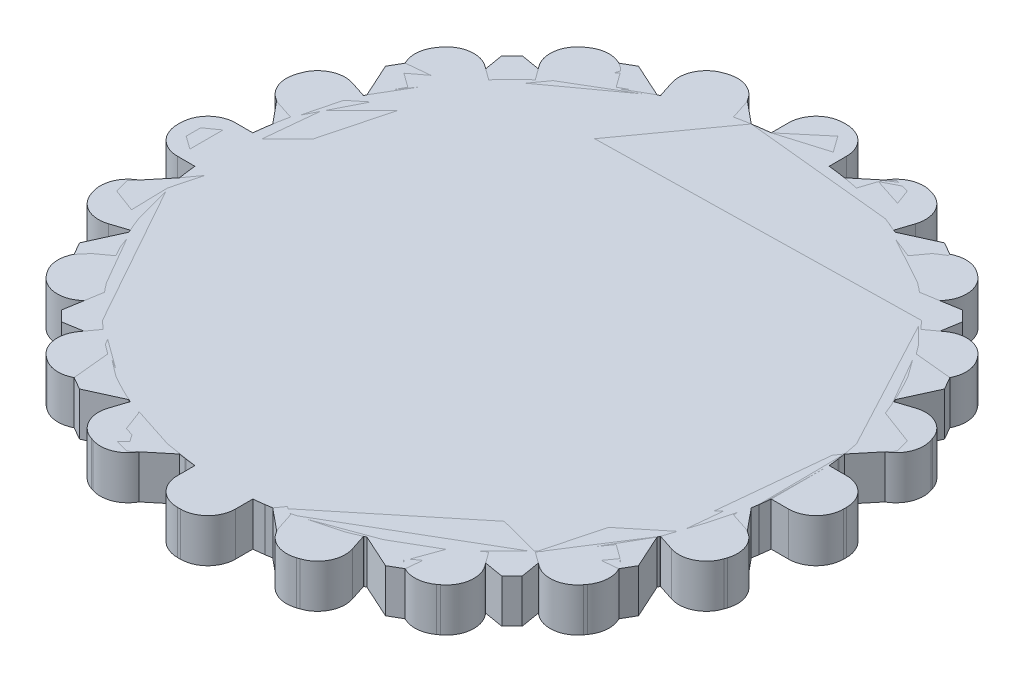
from build123d import *

# Parameters (mm, degrees)
BOSS_EXTRUDE3_DEPTH = 3
BOSS_EXTRUDE5_DEPTH = 3
SKETCH1_W           = 5
SKETCH1_H           = 3
BOSS_EXTRUDE6_DEPTH = 3


with BuildPart() as part:
    # Sketch2 → Boss-Extrude3 (new body)
    with BuildSketch(Plane(origin=(0, 0, 0), x_dir=(1, 0, 0), z_dir=(0, 1, 0))):
        with BuildLine():
            Line((-23, 0.1), (-23, -0.1))
            ThreePointArc((-23, -0.1), (-22.443502884, -1.443502884), (-21.1, -2))
            Line((-21.1, -2), (-19.899748742, -2))
            ThreePointArc((-19.899748742, -2), (-19.753766812, -3.128689301), (-19.543819703, -4.247247513))
            Line((-19.543819703, -4.247247513), (-20.685326483, -4.618145549))
            ThreePointArc((-20.685326483, -4.618145549), (-21.791106589, -5.56257098), (-21.905201574, -7.012285219))
            Line((-21.905201574, -7.012285219), (-21.843398175, -7.202496522))
            ThreePointArc((-21.843398175, -7.202496522), (-20.898972744, -8.308276629), (-19.449258505, -8.422371614))
            Line((-19.449258505, -8.422371614), (-18.307751725, -8.051473578))
            ThreePointArc((-18.307751725, -8.051473578), (-17.820130484, -9.079809995), (-17.274805421, -10.078744846))
            Line((-17.274805421, -10.078744846), (-18.245829086, -10.784234835))
            ThreePointArc((-18.245829086, -10.784234835), (-19.005644954, -12.02414164), (-18.666169396, -13.438159103))
            Line((-18.666169396, -13.438159103), (-18.548612345, -13.599962502))
            ThreePointArc((-18.548612345, -13.599962502), (-17.30870554, -14.35977837), (-15.894688077, -14.020302812))
            Line((-15.894688077, -14.020302812), (-14.923664412, -13.314812824))
            ThreePointArc((-14.923664412, -13.314812824), (-14.142135624, -14.142135624), (-13.314812824, -14.923664412))
            Line((-13.314812824, -14.923664412), (-14.020302812, -15.894688077))
            ThreePointArc((-14.020302812, -15.894688077), (-14.35977837, -17.30870554), (-13.599962502, -18.548612345))
            Line((-13.599962502, -18.548612345), (-13.438159103, -18.666169396))
            ThreePointArc((-13.438159103, -18.666169396), (-12.02414164, -19.005644954), (-10.784234835, -18.245829086))
            Line((-10.784234835, -18.245829086), (-10.078744846, -17.274805421))
            ThreePointArc((-10.078744846, -17.274805421), (-9.079809995, -17.820130484), (-8.051473578, -18.307751725))
            Line((-8.051473578, -18.307751725), (-8.422371614, -19.449258505))
            ThreePointArc((-8.422371614, -19.449258505), (-8.308276629, -20.898972744), (-7.202496522, -21.843398175))
            Line((-7.202496522, -21.843398175), (-7.012285219, -21.905201574))
            ThreePointArc((-7.012285219, -21.905201574), (-5.56257098, -21.791106589), (-4.618145549, -20.685326483))
            Line((-4.618145549, -20.685326483), (-4.247247513, -19.543819703))
            ThreePointArc((-4.247247513, -19.543819703), (-3.128689301, -19.753766812), (-2, -19.899748742))
            Line((-2, -19.899748742), (-2, -21.1))
            ThreePointArc((-2, -21.1), (-1.443502884, -22.443502884), (-0.1, -23))
            Line((-0.1, -23), (0.1, -23))
            ThreePointArc((0.1, -23), (1.443502884, -22.443502884), (2, -21.1))
            Line((2, -21.1), (2, -19.899748742))
            ThreePointArc((2, -19.899748742), (3.128689301, -19.753766812), (4.247247513, -19.543819703))
            Line((4.247247513, -19.543819703), (4.618145549, -20.685326483))
            ThreePointArc((4.618145549, -20.685326483), (5.56257098, -21.791106589), (7.012285219, -21.905201574))
            Line((7.012285219, -21.905201574), (7.202496522, -21.843398175))
            ThreePointArc((7.202496522, -21.843398175), (8.308276629, -20.898972744), (8.422371614, -19.449258505))
            Line((8.422371614, -19.449258505), (8.051473578, -18.307751725))
            ThreePointArc((8.051473578, -18.307751725), (9.079809995, -17.820130484), (10.078744846, -17.274805421))
            Line((10.078744846, -17.274805421), (10.784234835, -18.245829086))
            ThreePointArc((10.784234835, -18.245829086), (12.02414164, -19.005644954), (13.438159103, -18.666169396))
            Line((13.438159103, -18.666169396), (13.599962502, -18.548612345))
            ThreePointArc((13.599962502, -18.548612345), (14.35977837, -17.30870554), (14.020302812, -15.894688077))
            Line((14.020302812, -15.894688077), (13.314812824, -14.923664412))
            ThreePointArc((13.314812824, -14.923664412), (14.142135624, -14.142135624), (14.923664412, -13.314812824))
            Line((14.923664412, -13.314812824), (15.894688077, -14.020302812))
            ThreePointArc((15.894688077, -14.020302812), (17.30870554, -14.35977837), (18.548612345, -13.599962502))
            Line((18.548612345, -13.599962502), (18.666169396, -13.438159103))
            ThreePointArc((18.666169396, -13.438159103), (19.005644954, -12.02414164), (18.245829086, -10.784234835))
            Line((18.245829086, -10.784234835), (17.274805421, -10.078744846))
            ThreePointArc((17.274805421, -10.078744846), (17.820130484, -9.079809995), (18.307751725, -8.051473578))
            Line((18.307751725, -8.051473578), (19.449258505, -8.422371614))
            ThreePointArc((19.449258505, -8.422371614), (20.898972744, -8.308276629), (21.843398175, -7.202496522))
            Line((21.843398175, -7.202496522), (21.905201574, -7.012285219))
            ThreePointArc((21.905201574, -7.012285219), (21.791106589, -5.56257098), (20.685326483, -4.618145549))
            Line((20.685326483, -4.618145549), (19.543819703, -4.247247513))
            ThreePointArc((19.543819703, -4.247247513), (19.753766812, -3.128689301), (19.899748742, -2))
            Line((19.899748742, -2), (21.1, -2))
            ThreePointArc((21.1, -2), (22.443502884, -1.443502884), (23, -0.1))
            Line((23, -0.1), (23, 0.1))
            ThreePointArc((23, 0.1), (22.443502884, 1.443502884), (21.1, 2))
            Line((21.1, 2), (19.899748742, 2))
            ThreePointArc((19.899748742, 2), (19.753766812, 3.128689301), (19.543819703, 4.247247513))
            Line((19.543819703, 4.247247513), (20.685326483, 4.618145549))
            ThreePointArc((20.685326483, 4.618145549), (21.791106589, 5.56257098), (21.905201574, 7.012285219))
            Line((21.905201574, 7.012285219), (21.843398175, 7.202496522))
            ThreePointArc((21.843398175, 7.202496522), (20.898972744, 8.308276629), (19.449258505, 8.422371614))
            Line((19.449258505, 8.422371614), (18.307751725, 8.051473578))
            ThreePointArc((18.307751725, 8.051473578), (17.820130484, 9.079809995), (17.274805421, 10.078744846))
            Line((17.274805421, 10.078744846), (18.245829086, 10.784234835))
            ThreePointArc((18.245829086, 10.784234835), (19.005644954, 12.02414164), (18.666169396, 13.438159103))
            Line((18.666169396, 13.438159103), (18.548612345, 13.599962502))
            ThreePointArc((18.548612345, 13.599962502), (17.30870554, 14.35977837), (15.894688077, 14.020302812))
            Line((15.894688077, 14.020302812), (14.923664412, 13.314812824))
            ThreePointArc((14.923664412, 13.314812824), (14.142135624, 14.142135624), (13.314812824, 14.923664412))
            Line((13.314812824, 14.923664412), (14.020302812, 15.894688077))
            ThreePointArc((14.020302812, 15.894688077), (14.35977837, 17.30870554), (13.599962502, 18.548612345))
            Line((13.599962502, 18.548612345), (13.438159103, 18.666169396))
            ThreePointArc((13.438159103, 18.666169396), (12.02414164, 19.005644954), (10.784234835, 18.245829086))
            Line((10.784234835, 18.245829086), (10.078744846, 17.274805421))
            ThreePointArc((10.078744846, 17.274805421), (9.079809995, 17.820130484), (8.051473578, 18.307751725))
            Line((8.051473578, 18.307751725), (8.422371614, 19.449258505))
            ThreePointArc((8.422371614, 19.449258505), (8.308276629, 20.898972744), (7.202496522, 21.843398175))
            Line((7.202496522, 21.843398175), (7.012285219, 21.905201574))
            ThreePointArc((7.012285219, 21.905201574), (5.56257098, 21.791106589), (4.618145549, 20.685326483))
            Line((4.618145549, 20.685326483), (4.247247513, 19.543819703))
            ThreePointArc((4.247247513, 19.543819703), (3.128689301, 19.753766812), (2, 19.899748742))
            Line((2, 19.899748742), (2, 21.1))
            ThreePointArc((2, 21.1), (1.443502884, 22.443502884), (0.1, 23))
            Line((0.1, 23), (-0.1, 23))
            ThreePointArc((-0.1, 23), (-1.443502884, 22.443502884), (-2, 21.1))
            Line((-2, 21.1), (-2, 19.899748742))
            ThreePointArc((-2, 19.899748742), (-3.128689301, 19.753766812), (-4.247247513, 19.543819703))
            Line((-4.247247513, 19.543819703), (-4.618145549, 20.685326483))
            ThreePointArc((-4.618145549, 20.685326483), (-5.56257098, 21.791106589), (-7.012285219, 21.905201574))
            Line((-7.012285219, 21.905201574), (-7.202496522, 21.843398175))
            ThreePointArc((-7.202496522, 21.843398175), (-8.308276629, 20.898972744), (-8.422371614, 19.449258505))
            Line((-8.422371614, 19.449258505), (-8.051473578, 18.307751725))
            ThreePointArc((-8.051473578, 18.307751725), (-9.079809995, 17.820130484), (-10.078744846, 17.274805421))
            Line((-10.078744846, 17.274805421), (-10.784234835, 18.245829086))
            ThreePointArc((-10.784234835, 18.245829086), (-12.02414164, 19.005644954), (-13.438159103, 18.666169396))
            Line((-13.438159103, 18.666169396), (-13.599962502, 18.548612345))
            ThreePointArc((-13.599962502, 18.548612345), (-14.35977837, 17.30870554), (-14.020302812, 15.894688077))
            Line((-14.020302812, 15.894688077), (-13.314812824, 14.923664412))
            ThreePointArc((-13.314812824, 14.923664412), (-14.142135624, 14.142135624), (-14.923664412, 13.314812824))
            Line((-14.923664412, 13.314812824), (-15.894688077, 14.020302812))
            ThreePointArc((-15.894688077, 14.020302812), (-17.30870554, 14.35977837), (-18.548612345, 13.599962502))
            Line((-18.548612345, 13.599962502), (-18.666169396, 13.438159103))
            ThreePointArc((-18.666169396, 13.438159103), (-19.005644954, 12.02414164), (-18.245829086, 10.784234835))
            Line((-18.245829086, 10.784234835), (-17.274805421, 10.078744846))
            ThreePointArc((-17.274805421, 10.078744846), (-17.820130484, 9.079809995), (-18.307751725, 8.051473578))
            Line((-18.307751725, 8.051473578), (-19.449258505, 8.422371614))
            ThreePointArc((-19.449258505, 8.422371614), (-20.898972744, 8.308276629), (-21.843398175, 7.202496522))
            Line((-21.843398175, 7.202496522), (-21.905201574, 7.012285219))
            ThreePointArc((-21.905201574, 7.012285219), (-21.791106589, 5.56257098), (-20.685326483, 4.618145549))
            Line((-20.685326483, 4.618145549), (-19.543819703, 4.247247513))
            ThreePointArc((-19.543819703, 4.247247513), (-19.753766812, 3.128689301), (-19.899748742, 2))
            Line((-19.899748742, 2), (-21.1, 2))
            ThreePointArc((-21.1, 2), (-22.443502884, 1.443502884), (-23, 0.1))
        make_face()
    extrude(amount=BOSS_EXTRUDE3_DEPTH)


with BuildPart() as body_2:
    # Sketch3 → Boss-Extrude5 (new body)
    with BuildSketch(Plane(origin=(0, 0, 0), x_dir=(1, 0, 0), z_dir=(0, 1, 0))):
        with BuildLine():
            Line((-22, 0.5), (-22, -0.5))
            Line((-22, -0.5), (-19.899748742, -2))
            ThreePointArc((-19.899748742, -2), (-19.828897227, -2.610523844), (-19.739319337, -3.218582315))
            Line((-19.739319337, -3.218582315), (-21.379777701, -5.211056079))
            Line((-21.379777701, -5.211056079), (-21.120958656, -6.176981905))
            Line((-21.120958656, -6.176981905), (-18.704043156, -7.08228562))
            ThreePointArc((-18.704043156, -7.08228562), (-18.47759065, -7.653668647), (-18.23368794, -8.217823563))
            Line((-18.23368794, -8.217823563), (-19.302558883, -10.566987298))
            Line((-19.302558883, -10.566987298), (-18.802558883, -11.433012702))
            Line((-18.802558883, -11.433012702), (-16.23368794, -11.681925179))
            ThreePointArc((-16.23368794, -11.681925179), (-15.867066806, -12.17522858), (-15.485460842, -12.657033717))
            Line((-15.485460842, -12.657033717), (-15.909902577, -15.202795796))
            Line((-15.909902577, -15.202795796), (-15.202795796, -15.909902577))
            Line((-15.202795796, -15.909902577), (-12.657033717, -15.485460842))
            ThreePointArc((-12.657033717, -15.485460842), (-12.17522858, -15.867066806), (-11.681925179, -16.23368794))
            Line((-11.681925179, -16.23368794), (-11.433012702, -18.802558883))
            Line((-11.433012702, -18.802558883), (-10.566987298, -19.302558883))
            Line((-10.566987298, -19.302558883), (-8.217823563, -18.23368794))
            ThreePointArc((-8.217823563, -18.23368794), (-7.653668647, -18.47759065), (-7.08228562, -18.704043156))
            Line((-7.08228562, -18.704043156), (-6.176981905, -21.120958656))
            Line((-6.176981905, -21.120958656), (-5.211056079, -21.379777701))
            Line((-5.211056079, -21.379777701), (-3.218582315, -19.739319337))
            ThreePointArc((-3.218582315, -19.739319337), (-2.610523844, -19.828897227), (-2, -19.899748742))
            Line((-2, -19.899748742), (-0.5, -22))
            Line((-0.5, -22), (0.5, -22))
            Line((0.5, -22), (2, -19.899748742))
            ThreePointArc((2, -19.899748742), (2.610523844, -19.828897227), (3.218582315, -19.739319337))
            Line((3.218582315, -19.739319337), (5.211056079, -21.379777701))
            Line((5.211056079, -21.379777701), (6.176981905, -21.120958656))
            Line((6.176981905, -21.120958656), (7.08228562, -18.704043156))
            ThreePointArc((7.08228562, -18.704043156), (7.653668647, -18.47759065), (8.217823563, -18.23368794))
            Line((8.217823563, -18.23368794), (10.566987298, -19.302558883))
            Line((10.566987298, -19.302558883), (11.433012702, -18.802558883))
            Line((11.433012702, -18.802558883), (11.681925179, -16.23368794))
            ThreePointArc((11.681925179, -16.23368794), (12.17522858, -15.867066806), (12.657033717, -15.485460842))
            Line((12.657033717, -15.485460842), (15.202795796, -15.909902577))
            Line((15.202795796, -15.909902577), (15.909902577, -15.202795796))
            Line((15.909902577, -15.202795796), (15.485460842, -12.657033717))
            ThreePointArc((15.485460842, -12.657033717), (15.867066806, -12.17522858), (16.23368794, -11.681925179))
            Line((16.23368794, -11.681925179), (18.802558883, -11.433012702))
            Line((18.802558883, -11.433012702), (19.302558883, -10.566987298))
            Line((19.302558883, -10.566987298), (18.23368794, -8.217823563))
            ThreePointArc((18.23368794, -8.217823563), (18.47759065, -7.653668647), (18.704043156, -7.08228562))
            Line((18.704043156, -7.08228562), (21.120958656, -6.176981905))
            Line((21.120958656, -6.176981905), (21.379777701, -5.211056079))
            Line((21.379777701, -5.211056079), (19.739319337, -3.218582315))
            ThreePointArc((19.739319337, -3.218582315), (19.828897227, -2.610523844), (19.899748742, -2))
            Line((19.899748742, -2), (22, -0.5))
            Line((22, -0.5), (22, 0.5))
            Line((22, 0.5), (19.899748742, 2))
            ThreePointArc((19.899748742, 2), (19.828897227, 2.610523844), (19.739319337, 3.218582315))
            Line((19.739319337, 3.218582315), (21.379777701, 5.211056079))
            Line((21.379777701, 5.211056079), (21.120958656, 6.176981905))
            Line((21.120958656, 6.176981905), (18.704043156, 7.08228562))
            ThreePointArc((18.704043156, 7.08228562), (18.47759065, 7.653668647), (18.23368794, 8.217823563))
            Line((18.23368794, 8.217823563), (19.302558883, 10.566987298))
            Line((19.302558883, 10.566987298), (18.802558883, 11.433012702))
            Line((18.802558883, 11.433012702), (16.23368794, 11.681925179))
            ThreePointArc((16.23368794, 11.681925179), (15.867066806, 12.17522858), (15.485460842, 12.657033717))
            Line((15.485460842, 12.657033717), (15.909902577, 15.202795796))
            Line((15.909902577, 15.202795796), (15.202795796, 15.909902577))
            Line((15.202795796, 15.909902577), (12.657033717, 15.485460842))
            ThreePointArc((12.657033717, 15.485460842), (12.17522858, 15.867066806), (11.681925179, 16.23368794))
            Line((11.681925179, 16.23368794), (11.433012702, 18.802558883))
            Line((11.433012702, 18.802558883), (10.566987298, 19.302558883))
            Line((10.566987298, 19.302558883), (8.217823563, 18.23368794))
            ThreePointArc((8.217823563, 18.23368794), (7.653668647, 18.47759065), (7.08228562, 18.704043156))
            Line((7.08228562, 18.704043156), (6.176981905, 21.120958656))
            Line((6.176981905, 21.120958656), (5.211056079, 21.379777701))
            Line((5.211056079, 21.379777701), (3.218582315, 19.739319337))
            ThreePointArc((3.218582315, 19.739319337), (2.610523844, 19.828897227), (2, 19.899748742))
            Line((2, 19.899748742), (0.5, 22))
            Line((0.5, 22), (-0.5, 22))
            Line((-0.5, 22), (-2, 19.899748742))
            ThreePointArc((-2, 19.899748742), (-2.610523844, 19.828897227), (-3.218582315, 19.739319337))
            Line((-3.218582315, 19.739319337), (-5.211056079, 21.379777701))
            Line((-5.211056079, 21.379777701), (-6.176981905, 21.120958656))
            Line((-6.176981905, 21.120958656), (-7.08228562, 18.704043156))
            ThreePointArc((-7.08228562, 18.704043156), (-7.653668647, 18.47759065), (-8.217823563, 18.23368794))
            Line((-8.217823563, 18.23368794), (-10.566987298, 19.302558883))
            Line((-10.566987298, 19.302558883), (-11.433012702, 18.802558883))
            Line((-11.433012702, 18.802558883), (-11.681925179, 16.23368794))
            ThreePointArc((-11.681925179, 16.23368794), (-12.17522858, 15.867066806), (-12.657033717, 15.485460842))
            Line((-12.657033717, 15.485460842), (-15.202795796, 15.909902577))
            Line((-15.202795796, 15.909902577), (-15.909902577, 15.202795796))
            Line((-15.909902577, 15.202795796), (-15.485460842, 12.657033717))
            ThreePointArc((-15.485460842, 12.657033717), (-15.867066806, 12.17522858), (-16.23368794, 11.681925179))
            Line((-16.23368794, 11.681925179), (-18.802558883, 11.433012702))
            Line((-18.802558883, 11.433012702), (-19.302558883, 10.566987298))
            Line((-19.302558883, 10.566987298), (-18.23368794, 8.217823563))
            ThreePointArc((-18.23368794, 8.217823563), (-18.47759065, 7.653668647), (-18.704043156, 7.08228562))
            Line((-18.704043156, 7.08228562), (-21.120958656, 6.176981905))
            Line((-21.120958656, 6.176981905), (-21.379777701, 5.211056079))
            Line((-21.379777701, 5.211056079), (-19.739319337, 3.218582315))
            ThreePointArc((-19.739319337, 3.218582315), (-19.828897227, 2.610523844), (-19.899748742, 2))
            Line((-19.899748742, 2), (-22, 0.5))
        make_face()
    extrude(amount=BOSS_EXTRUDE5_DEPTH)


with BuildPart() as body_3:
    # Sketch1 → Boss-Extrude6 (new body)
    with BuildSketch(Plane(origin=(0, 0, 0), x_dir=(1, 0, 0), z_dir=(0, 1, 0))):
        with BuildLine():
            Line((-1.142396869, 15.366895677), (-0.142396869, 15.366895677))
            Line((-0.142396869, 15.366895677), (1.357603131, 13.164854648))
            ThreePointArc((1.357603131, 13.164854648), (1.945793582, 13.026153939), (2.524531809, 12.852177051))
            Line((2.524531809, 12.852177051), (4.924590429, 14.009200522))
            Line((4.924590429, 14.009200522), (5.790615833, 13.509200522))
            Line((5.790615833, 13.509200522), (5.988633424, 10.852177051))
            ThreePointArc((5.988633424, 10.852177051), (6.428670943, 10.437963488), (6.842884505, 9.99792597))
            Line((6.842884505, 9.99792597), (9.499907976, 9.799908378))
            Line((9.499907976, 9.799908378), (9.999907976, 8.933882975))
            Line((9.999907976, 8.933882975), (8.842884505, 6.533824355))
            ThreePointArc((8.842884505, 6.533824355), (9.016861394, 5.955086128), (9.155562102, 5.366895677))
            Line((9.155562102, 5.366895677), (11.357603131, 3.866895677))
            Line((11.357603131, 3.866895677), (11.357603131, 2.866895677))
            Line((11.357603131, 2.866895677), (9.155562102, 1.366895677))
            ThreePointArc((9.155562102, 1.366895677), (9.016861394, 0.778705226), (8.842884505, 0.199966999))
            Line((8.842884505, 0.199966999), (9.999907976, -2.200091622))
            Line((9.999907976, -2.200091622), (9.499907976, -3.066117025))
            Line((9.499907976, -3.066117025), (6.842884505, -3.264134617))
            ThreePointArc((6.842884505, -3.264134617), (6.428670943, -3.704172135), (5.988633424, -4.118385698))
            Line((5.988633424, -4.118385698), (5.790615833, -6.775409169))
            Line((5.790615833, -6.775409169), (4.924590429, -7.275409169))
            Line((4.924590429, -7.275409169), (2.524531809, -6.118385698))
            ThreePointArc((2.524531809, -6.118385698), (1.945793582, -6.292362586), (1.357603131, -6.431063295))
            Line((1.357603131, -6.431063295), (-0.142396869, -8.633104323))
            Line((-0.142396869, -8.633104323), (-1.142396869, -8.633104323))
            Line((-1.142396869, -8.633104323), (-2.642396869, -6.431063295))
            ThreePointArc((-2.642396869, -6.431063295), (-3.23058732, -6.292362586), (-3.809325547, -6.118385698))
            Line((-3.809325547, -6.118385698), (-6.209384167, -7.275409169))
            Line((-6.209384167, -7.275409169), (-7.075409571, -6.775409169))
            Line((-7.075409571, -6.775409169), (-7.273427162, -4.118385698))
            ThreePointArc((-7.273427162, -4.118385698), (-7.713464681, -3.704172135), (-8.127678243, -3.264134617))
            Line((-8.127678243, -3.264134617), (-10.784701714, -3.066117025))
            Line((-10.784701714, -3.066117025), (-11.284701714, -2.200091622))
            Line((-11.284701714, -2.200091622), (-10.127678243, 0.199966999))
            ThreePointArc((-10.127678243, 0.199966999), (-10.301655132, 0.778705226), (-10.44035584, 1.366895677))
            Line((-10.44035584, 1.366895677), (-12.642396869, 2.866895677))
            Line((-12.642396869, 2.866895677), (-12.642396869, 3.866895677))
            Line((-12.642396869, 3.866895677), (-10.44035584, 5.366895677))
            ThreePointArc((-10.44035584, 5.366895677), (-10.301655132, 5.955086128), (-10.127678243, 6.533824355))
            Line((-10.127678243, 6.533824355), (-11.284701714, 8.933882975))
            Line((-11.284701714, 8.933882975), (-10.784701714, 9.799908378))
            Line((-10.784701714, 9.799908378), (-8.127678243, 9.99792597))
            ThreePointArc((-8.127678243, 9.99792597), (-7.713464681, 10.437963488), (-7.273427162, 10.852177051))
            Line((-7.273427162, 10.852177051), (-7.075409571, 13.509200522))
            Line((-7.075409571, 13.509200522), (-6.209384167, 14.009200522))
            Line((-6.209384167, 14.009200522), (-3.809325547, 12.852177051))
            ThreePointArc((-3.809325547, 12.852177051), (-3.23058732, 13.026153939), (-2.642396869, 13.164854648))
            Line((-2.642396869, 13.164854648), (-1.142396869, 15.366895677))
        make_face()
        with Locations((-0.642396869, 3.366895677)):
            Rectangle(SKETCH1_W, SKETCH1_H, mode=Mode.SUBTRACT)
    extrude(amount=BOSS_EXTRUDE6_DEPTH)


solid = Compound([part.part, body_2.part, body_3.part])
